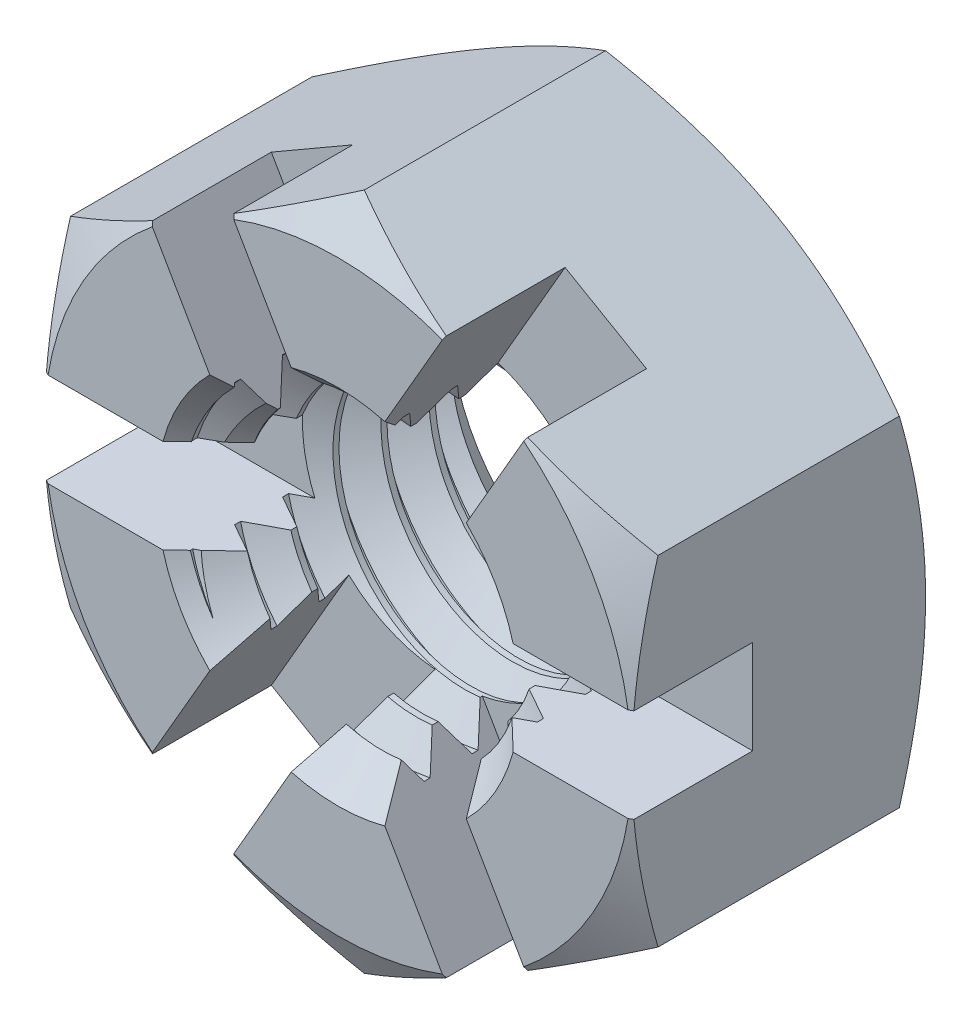
from build123d import *

# Parameters (mm, degrees)
EXTRUDE1_DEPTH     = 5.55625
SKETCH2_OUTSIDE_W  = 55.29
SKETCH2_OUTSIDE_H  = 57.01
SKETCH2_OUTSIDE_R  = 5.55625
CUT_EXTRUDE1_DEPTH = 11.1442782
CUT_EXTRUDE1_DRAFT = -60
SKETCH3_OUTSIDE_W  = 55.29
SKETCH3_OUTSIDE_H  = 57.01
SKETCH3_OUTSIDE_R  = 5.55625
CUT_EXTRUDE2_DEPTH = 11.1442782
CUT_EXTRUDE2_DRAFT = -60
SKETCH4_R          = 3.175
CUT_EXTRUDE3_DEPTH = 11.1442782
SKETCH12_R         = 3.175
SKETCH12_R_2       = 2.585793431
EXTRUDE2_DEPTH     = 5.55625
CUT_SWEEP1_PITCH   = 0.907142857
CUT_EXTRUDE8_DEPTH = 2.286
CIRPATTERN1_COUNT  = 6


with BuildPart() as part:
    # Sketch1 → Extrude1 (new body)
    with BuildSketch(Plane.XY):
        Polygon((0, 6.415804866), (-5.55625, 3.207902433), (-5.55625, -3.207902433), (0, -6.415804866), (5.55625, -3.207902433), (5.55625, 3.207902433), align=None)
    extrude(amount=-EXTRUDE1_DEPTH)


with BuildPart() as cut_extrude1_tool:
    # Sketch2 outside → Cut-Extrude1 (with draft: the straight prism first)
    with BuildSketch(Plane.XY):
        Rectangle(SKETCH2_OUTSIDE_W, SKETCH2_OUTSIDE_H)
        Circle(SKETCH2_OUTSIDE_R, mode=Mode.SUBTRACT)
    extrude(amount=-CUT_EXTRUDE1_DEPTH)
    # Cut-Extrude1: the draft: its side faces are tilted about the plane it starts from
    cut_extrude1_sides = [cut_extrude1_tool.faces().sort_by_distance(p)[0] for p in [
        (0, -28.505, -5.5721391),
        (27.645, 0, -5.5721391),
        (0, 28.505, -5.5721391),
        (-27.645, 0, -5.5721391),
        (-5.55625, 0, -5.5721391),
    ]]
    draft(cut_extrude1_sides, Plane.XY, CUT_EXTRUDE1_DRAFT)


with BuildPart() as part_1:
    add(part.part)

    # Cut-Extrude1: cut by cut_extrude1_tool
    add(cut_extrude1_tool.part, mode=Mode.SUBTRACT)


with BuildPart() as cut_extrude2_tool:
    # Sketch3 outside → Cut-Extrude2 (with draft: the straight prism first)
    with BuildSketch(Plane(origin=(0, 0, -5.55625), x_dir=(-1, 0, 0), z_dir=(0, 0, -1))):
        Rectangle(SKETCH3_OUTSIDE_W, SKETCH3_OUTSIDE_H)
        Circle(SKETCH3_OUTSIDE_R, mode=Mode.SUBTRACT)
    extrude(amount=-CUT_EXTRUDE2_DEPTH)
    # Cut-Extrude2: the draft: its side faces are tilted about the plane it starts from
    cut_extrude2_sides = [cut_extrude2_tool.faces().sort_by_distance(p)[0] for p in [
        (0, -28.505, 0.0158891),
        (-27.645, 0, 0.0158891),
        (0, 28.505, 0.0158891),
        (27.645, 0, 0.0158891),
        (5.55625, 0, 0.0158891),
    ]]
    draft(cut_extrude2_sides, Plane(origin=(0, 0, -5.55625), x_dir=(-1, 0, 0), z_dir=(0, 0, -1)), CUT_EXTRUDE2_DRAFT)


with BuildPart() as part_2:
    add(part_1.part)

    # Cut-Extrude2: cut by cut_extrude2_tool
    add(cut_extrude2_tool.part, mode=Mode.SUBTRACT)

    # Sketch4 → Cut-Extrude3 (cut, through all)
    with BuildSketch(Plane.XY):
        Circle(SKETCH4_R)
    extrude(amount=-CUT_EXTRUDE3_DEPTH, mode=Mode.SUBTRACT)

    # Sketch12 → Extrude2 (add)
    with BuildSketch(Plane.XY):
        Circle(SKETCH12_R)
        Circle(SKETCH12_R_2, mode=Mode.SUBTRACT)
    extrude(amount=-EXTRUDE2_DEPTH)

    # Cut-Sweep1: the profile of Sketch9 profile screwed along a right-hand helix of 7.125 turns, 6 arcs to a turn; built about Z, then put on its axis
    cut_sweep1_z = Axis((0, 0, 0), (0, 0, 1))
    cut_sweep1_corners = [(3.175, 0, -0.453571429), (3.175, 0, -0.340178571), (2.585493431, 0, 0.000173205), (2.585493431, 0, -0.793923205)]
    with BuildLine(mode=Mode.PRIVATE) as cut_sweep1_profile:
        Line(cut_sweep1_corners[0], cut_sweep1_corners[1])
        Line(cut_sweep1_corners[1], cut_sweep1_corners[2])
        Line(cut_sweep1_corners[2], cut_sweep1_corners[3])
        Line(cut_sweep1_corners[3], cut_sweep1_corners[0])
    cut_sweep1_cap = Face(cut_sweep1_profile.wire())
    cut_sweep1_turn_angles = [0, 30, 60, 90, 120, 150, 180, 210, 240, 270, 300, 330, 360]
    cut_sweep1_turn_weights = [1, 0.8660254037844387, 1, 0.8660254037844387, 1, 0.8660254037844387, 1, 0.8660254037844387, 1, 0.8660254037844387, 1, 0.8660254037844387, 1]
    cut_sweep1_turn_rails = [Edge.make_bspline([Vector(p[0], p[1], 0).rotate(cut_sweep1_z, cut_sweep1_turn_angles[k]) / cut_sweep1_turn_weights[k] + Vector(0, 0, p[2] + CUT_SWEEP1_PITCH * cut_sweep1_turn_angles[k] / 360) for k in range(13)], [0, 0, 0, 1, 1, 2, 2, 3, 3, 4, 4, 5, 5, 6, 6, 6], 2, cut_sweep1_turn_weights) for p in cut_sweep1_corners]
    cut_sweep1_turn_sides = [Face.make_surface_from_curves(cut_sweep1_turn_rails[p[0]], cut_sweep1_turn_rails[p[1]]) for p in [(0, 1), (1, 2), (2, 3), (3, 0)]]
    cut_sweep1_last_angles = [2520, 2542.5, 2565]
    cut_sweep1_last_weights = [1, 0.9238795325112624, 1]
    cut_sweep1_last_rails = [Edge.make_bspline([Vector(p[0], p[1], 0).rotate(cut_sweep1_z, cut_sweep1_last_angles[k]) / cut_sweep1_last_weights[k] + Vector(0, 0, p[2] + CUT_SWEEP1_PITCH * cut_sweep1_last_angles[k] / 360) for k in range(3)], [0, 0, 0, 1, 1, 1], 2, cut_sweep1_last_weights) for p in cut_sweep1_corners]
    cut_sweep1_last_sides = [Face.make_surface_from_curves(cut_sweep1_last_rails[p[0]], cut_sweep1_last_rails[p[1]]) for p in [(0, 1), (1, 2), (2, 3), (3, 0)]]
    cut_sweep1 = Plane(origin=(0, 0, 0), x_dir=(0, 1, 0), z_dir=(0, 0, -1)) * Solid(Shell([*[p.moved(Location((0, 0, CUT_SWEEP1_PITCH * i))) for i in range(7) for p in cut_sweep1_turn_sides], *cut_sweep1_last_sides, cut_sweep1_cap, cut_sweep1_cap.rotate(cut_sweep1_z, 2565).moved(Location((0, 0, CUT_SWEEP1_PITCH * 2565 / 360)))]))
    add(cut_sweep1, mode=Mode.SUBTRACT)

    # Cut-Extrude6 cone 1 section (through the dimple's axis) → Cut-Extrude6 (revolve, cut)
    with BuildSketch(Plane(origin=(0, 0, 0), x_dir=(0, -1, 0), z_dir=(1, 0, 0))):
        Polygon((0, 0), (3.429, 0), (0, 3.429), align=None)
    revolve(axis=Axis((0, 0, 0), (0, 0, -1)), mode=Mode.SUBTRACT)

    # Cut-Extrude7 cone 1 section (through the dimple's axis) → Cut-Extrude7 (revolve, cut)
    with BuildSketch(Plane(origin=(0, 0, -5.55625), x_dir=(0, 1, 0), z_dir=(1, 0, 0))):
        Polygon((0, 0), (3.429, 0), (0, 3.429), align=None)
    revolve(axis=Axis((0, 0, -5.55625), (0, 0, 1)), mode=Mode.SUBTRACT)

    # Sketch13 → Cut-Extrude8 (cut)
    with BuildSketch(Plane.XY):
        Polygon((-0.769896584, 0.4445), (0.769896584, -0.4445), (3.548021584, 4.36735365), (2.008228416, 5.25635365), align=None)
    cut_extrude8 = extrude(amount=-CUT_EXTRUDE8_DEPTH, mode=Mode.SUBTRACT)

    # CirPattern1: Cut-Extrude8 ×6 about axis
    cirpattern1_axis = Axis((0, 0, 0), (0, 0, 1))
    for i in range(1, CIRPATTERN1_COUNT):
        add(cut_extrude8.rotate(cirpattern1_axis, i * 360 / CIRPATTERN1_COUNT), mode=Mode.SUBTRACT)


solid = part_2.part
